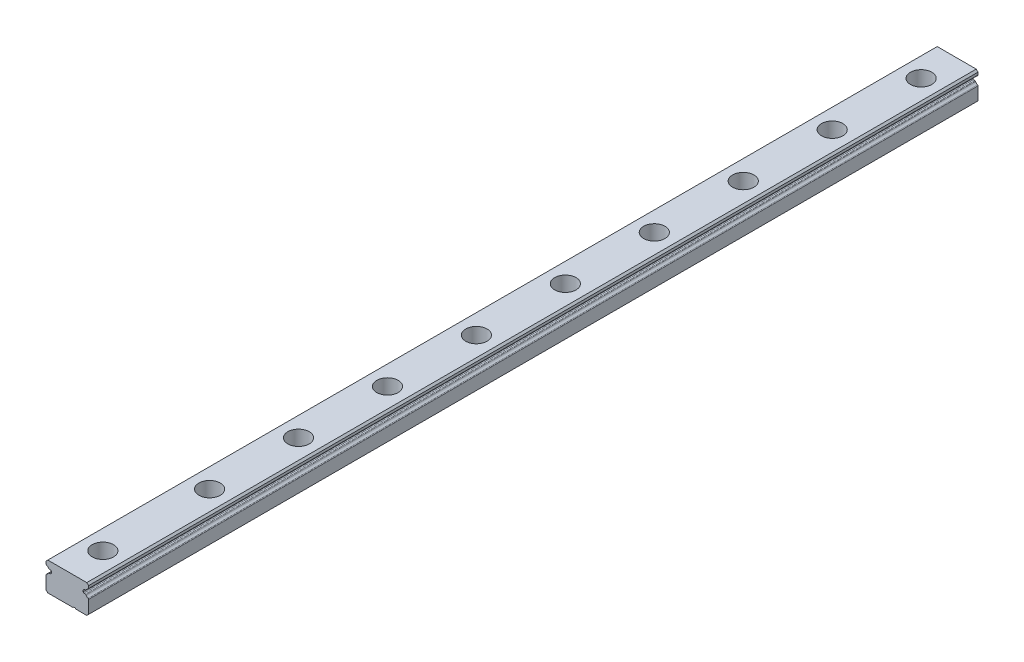
from build123d import *

# Parameters (mm, degrees)
RAIL_PROFILE_DEPTH             = 125
CBORE_FOR_M3_SHCS1_D           = 3.5
CBORE_FOR_M3_SHCS1_CBORE_D     = 6
CBORE_FOR_M3_SHCS1_CBORE_DEPTH = 4.5
FILL_START                     = -2.000000001
FILL_PATTERN1_OUTLINE_R        = 3
FILL_PATTERN1_DEPTH            = 4.5
FILL_START_2                   = -5.5
FILL_PATTERN1_2_OUTLINE_R      = 1.75
FILL_PATTERN1_2_DEPTH          = 3.499999999


# Read off the part's stored shape, not the designer's step: Fill Pattern1
with BuildPart() as part:
    # Sketch1 → RAIL PROFILE (new, symmetric)
    with BuildSketch(Plane.XY):
        with BuildLine():
            Line((-5.982334879, -1.370069213), (-5.982334879, -5.001472146))
            Line((-5.982334879, -5.001472146), (-5.483807025, -5.499999999))
            Line((-5.483807025, -5.499999999), (1.595289228, -5.499999999))
            ThreePointArc((1.595289228, -5.499999999), (1.994111552, -5.300588838), (2.392933875, -5.5))
            Line((2.392933875, -5.5), (5.483807024, -5.5))
            Line((5.483807024, -5.5), (5.982334878, -5.001472147))
            Line((5.982334878, -5.001472147), (5.982334878, -1.370069213))
            ThreePointArc((5.982334878, -1.370069213), (5.940056641, -1.231182813), (5.82756375, -1.139410101))
            ThreePointArc((5.82756375, -1.139410101), (5.497041405, -0.930122348), (5.251697363, -0.625405104))
            ThreePointArc((5.251697363, -0.625405104), (5.169975597, -0.541388466), (5.058890009, -0.504008866))
            Line((5.058890009, -0.504008866), (4.71429032, -0.473860299))
            ThreePointArc((4.71429032, -0.473860299), (4.552238438, -0.393945155), (4.486751147, -0.225544865))
            Line((4.486751147, -0.225544865), (4.486751147, 0.225544865))
            ThreePointArc((4.486751147, 0.225544865), (4.552238438, 0.393945155), (4.71429032, 0.473860299))
            Line((4.71429032, 0.473860299), (5.079776582, 0.505836204))
            ThreePointArc((5.079776582, 0.505836204), (5.187925163, 0.5413949), (5.268982803, 0.621333598))
            ThreePointArc((5.268982803, 0.621333598), (5.511607978, 0.899707672), (5.82756375, 1.09083865))
            ThreePointArc((5.82756375, 1.09083865), (5.940040963, 1.182638806), (5.982312115, 1.321532803))
            Line((5.982312115, 1.321532803), (5.982321902, 2.00145917))
            Line((5.982321902, 2.00145917), (5.483807025, 2.499999999))
            Line((5.483807025, 2.499999999), (-5.483807026, 2.499999999))
            Line((-5.483807026, 2.499999999), (-5.982321903, 2.00145917))
            Line((-5.982321903, 2.00145917), (-5.982321903, 1.32884687))
            ThreePointArc((-5.982321903, 1.32884687), (-5.942177076, 1.185718341), (-5.827697321, 1.090893402))
            ThreePointArc((-5.827697321, 1.090893402), (-5.511663234, 0.899754111), (-5.268982805, 0.621333597))
            ThreePointArc((-5.268982805, 0.621333597), (-5.187925164, 0.541394898), (-5.079776582, 0.505836204))
            Line((-5.079776582, 0.505836204), (-4.71429032, 0.473860299))
            ThreePointArc((-4.71429032, 0.473860299), (-4.552238438, 0.393945155), (-4.486751147, 0.225544865))
            Line((-4.486751147, 0.225544865), (-4.486751147, -0.225544865))
            ThreePointArc((-4.486751147, -0.225544865), (-4.552238438, -0.393945155), (-4.71429032, -0.473860299))
            Line((-4.71429032, -0.473860299), (-5.058890009, -0.504008866))
            ThreePointArc((-5.058890009, -0.504008866), (-5.169975597, -0.541388466), (-5.251697363, -0.625405104))
            ThreePointArc((-5.251697363, -0.625405104), (-5.499180752, -0.921502608), (-5.828043428, -1.123421157))
            ThreePointArc((-5.828043428, -1.123421157), (-5.944906256, -1.221900029), (-5.982334879, -1.370069213))
        make_face()
    extrude(amount=RAIL_PROFILE_DEPTH, both=True)

    # CBORE for M3 SHCS1 (through all)
    with Locations(Plane(origin=(0, 2.499999999, 0), x_dir=(1, 0, 0), z_dir=(0, 1, 0))):
        with Locations((0, 115)):
            cbore_for_m3_shcs1 = CounterBoreHole(CBORE_FOR_M3_SHCS1_D / 2, CBORE_FOR_M3_SHCS1_CBORE_D / 2, CBORE_FOR_M3_SHCS1_CBORE_DEPTH)

    # M3 END MIRROR: CBORE for M3 SHCS1 across plane
    add(cbore_for_m3_shcs1.mirror(Plane.XY), mode=Mode.SUBTRACT)

    # Fill Pattern1 outline → Fill Pattern1 (cut)
    with BuildSketch(Plane(origin=(0, 0, 0), x_dir=(1, 0, 0), z_dir=(0, 1, 0)).offset(FILL_START)):
        with Locations((0, 90)):
            Circle(FILL_PATTERN1_OUTLINE_R)
        with Locations((0, 65)):
            Circle(FILL_PATTERN1_OUTLINE_R)
        with Locations((0, 40)):
            Circle(FILL_PATTERN1_OUTLINE_R)
        with Locations((0, 15)):
            Circle(FILL_PATTERN1_OUTLINE_R)
        with Locations((0, -10)):
            Circle(FILL_PATTERN1_OUTLINE_R)
        with Locations((0, -35)):
            Circle(FILL_PATTERN1_OUTLINE_R)
        with Locations((0, -60)):
            Circle(FILL_PATTERN1_OUTLINE_R)
        with Locations((0, -85)):
            Circle(FILL_PATTERN1_OUTLINE_R)
    extrude(amount=FILL_PATTERN1_DEPTH, mode=Mode.SUBTRACT)

    # Fill Pattern1 2 outline → Fill Pattern1 2 (cut)
    with BuildSketch(Plane(origin=(0, 0, 0), x_dir=(1, 0, 0), z_dir=(0, 1, 0)).offset(FILL_START_2)):
        with Locations((0, 90)):
            Circle(FILL_PATTERN1_2_OUTLINE_R)
        with Locations((0, 65)):
            Circle(FILL_PATTERN1_2_OUTLINE_R)
        with Locations((0, 40)):
            Circle(FILL_PATTERN1_2_OUTLINE_R)
        with Locations((0, 15)):
            Circle(FILL_PATTERN1_2_OUTLINE_R)
        with Locations((0, -10)):
            Circle(FILL_PATTERN1_2_OUTLINE_R)
        with Locations((0, -35)):
            Circle(FILL_PATTERN1_2_OUTLINE_R)
        with Locations((0, -60)):
            Circle(FILL_PATTERN1_2_OUTLINE_R)
        with Locations((0, -85)):
            Circle(FILL_PATTERN1_2_OUTLINE_R)
    extrude(amount=FILL_PATTERN1_2_DEPTH, mode=Mode.SUBTRACT)


solid = part.part
